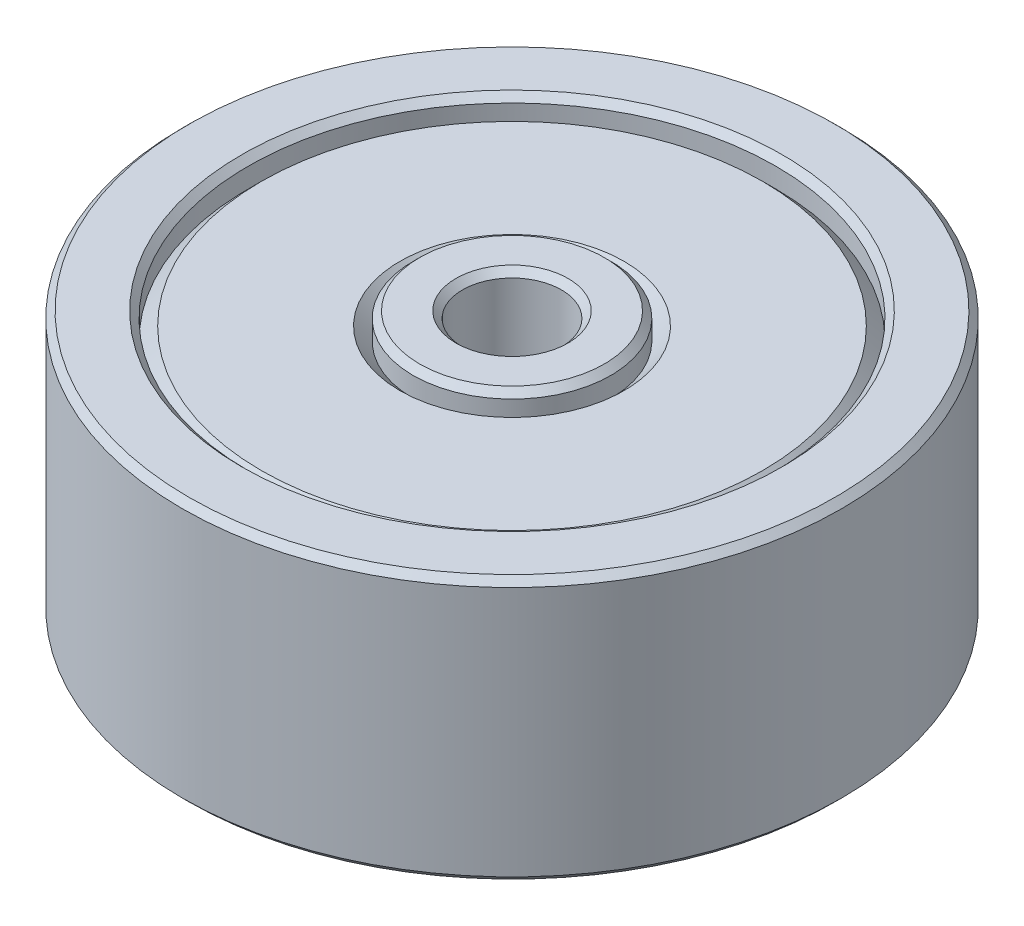
from build123d import *

# Parameters (mm, degrees)
SKETCH1_W     = 4.25
SKETCH1_H     = 4
CHAMFER1_SIZE = 0.1


with BuildPart() as part:
    # Sketch1 → Revolve1 (revolve)
    with BuildSketch(Plane(origin=(0, 0, 0), x_dir=(0, 0, -1), z_dir=(1, 0, 0))):
        with Locations((2.875, 0)):
            Rectangle(SKETCH1_W, SKETCH1_H)
    revolve(axis=Axis((0, 2, 0), (0, -1, 0)))

    # Sketch3 → Cut-Revolve2 (revolve, cut)
    with BuildSketch(Plane(origin=(0, 0, 0), x_dir=(0, 0, -1), z_dir=(1, 0, 0))):
        Polygon((4, 2), (1.5, 2), (1.5, 1.6), (1.7, 1.8), (3.8, 1.8), (4, 1.6), align=None)
    cut_revolve2 = revolve(axis=Axis((0, 2, 0), (0, -1, 0)), mode=Mode.SUBTRACT)

    # Mirror1: Cut-Revolve2 across plane
    add(cut_revolve2.mirror(Plane.ZX), mode=Mode.SUBTRACT)

    # Chamfer1
    chamfer1_edges = [part.edges().sort_by_distance(p)[0] for p in [
        (0, -2, 4),
        (0, 2, 4),
        (0, -2, 5),
        (0, 2, 5),
        (0, -2, 1.5),
        (0, 2, 1.5),
        (0, -2, 0.75),
        (0, 2, 0.75),
    ]]
    chamfer(chamfer1_edges, length=CHAMFER1_SIZE)


solid = part.part
